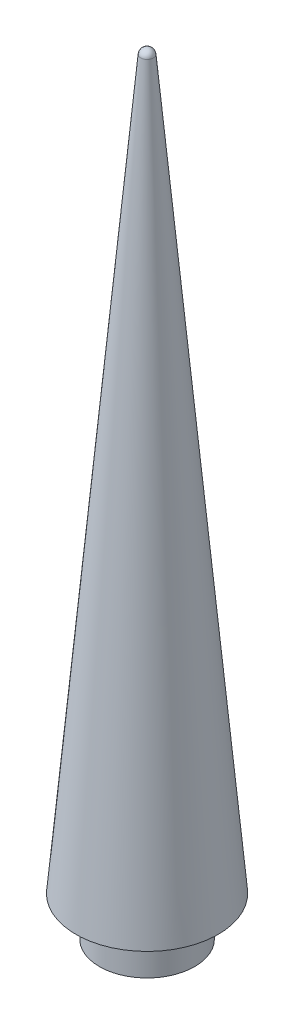
from build123d import *

# Parameters (mm, degrees)
SKETCH1_R                 = 7.62
BOSS_EXTRUDE1_DEPTH       = 6.35
F_6_32_TAPPED_HOLE1_D     = 2.7051
F_6_32_TAPPED_HOLE1_DEPTH = 9.398
F_6_32_TAPPED_HOLE1_TIP   = 0.81269403


with BuildPart() as part:
    # Sketch1 → Boss-Extrude1 (new body)
    with BuildSketch(Plane(origin=(0, 0, 0), x_dir=(1, 0, 0), z_dir=(0, 1, 0))):
        Circle(SKETCH1_R)
    extrude(amount=-BOSS_EXTRUDE1_DEPTH)

    # Sketch3 → Revolve1 (revolve)
    with BuildSketch(Plane.XY):
        with BuildLine():
            Line((0, 0), (11.39145745, 0))
            Line((11.39145745, 0), (1.011976427, 116.280968605))
            ThreePointArc((1.011976427, 116.280968605), (0.685740324, 116.940314889), (0, 117.206637485))
            Line((0, 117.206637485), (0, 0))
        make_face()
    revolve(axis=Axis((0, 0, 0), (0, 1, 0)))

    # #6-32 Tapped Hole1
    with Locations(Plane.XZ.offset(6.35)):
        with Locations((0, 0)):
            Hole(F_6_32_TAPPED_HOLE1_D / 2, depth=F_6_32_TAPPED_HOLE1_DEPTH)
            with Locations((0, 0, -(F_6_32_TAPPED_HOLE1_DEPTH + F_6_32_TAPPED_HOLE1_TIP / 2))):  # 118° drill point
                Cone(0, F_6_32_TAPPED_HOLE1_D / 2, F_6_32_TAPPED_HOLE1_TIP, mode=Mode.SUBTRACT)


solid = part.part
